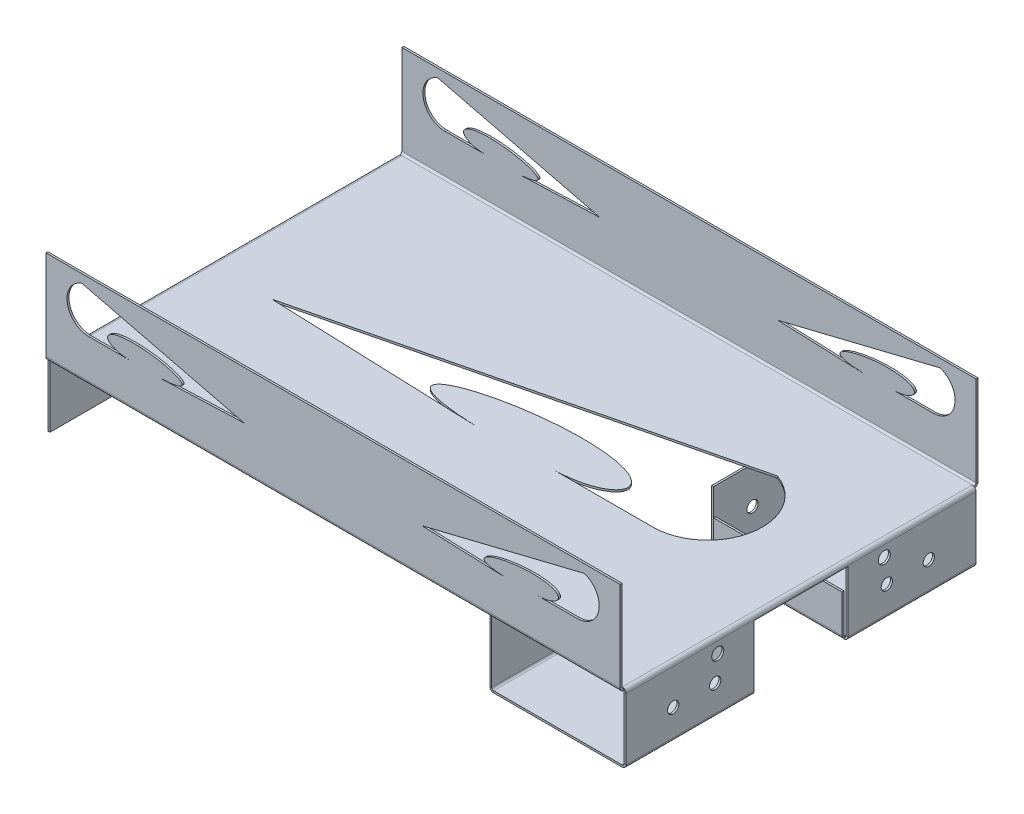
from build123d import *

# Parameters (mm, degrees)
BASE_FLANGE1_START             = -0.7366
BASE_FLANGE1_OUTLINE_W         = 219
BASE_FLANGE1_OUTLINE_H         = 135
BASE_FLANGE1_DEPTH             = 0.7366
EDGE_FLANGE1_STRIP_W           = 4.4196
EDGE_FLANGE1_STRIP_H           = 0.7366
EDGE_FLANGE1_STRIP_CUT_DEPTH   = 219
EDGE_FLANGE1_STRIP_2_W         = 4.4196
EDGE_FLANGE1_STRIP_2_H         = 0.7366
EDGE_FLANGE1_STRIP_CUT_2_DEPTH = 219
EDGE_FLANGE1_DEPTH             = 219
EDGE_FLANGE1_BEND_DEPTH        = 219
CUT_EXTRUDE1_DEPTH             = 179.438180724
EDGE_FLANGE2_STRIP_W           = 4.4196
EDGE_FLANGE2_STRIP_H           = 0.7366
EDGE_FLANGE2_STRIP_CUT_DEPTH   = 133.5268
EDGE_FLANGE2_DEPTH             = 133.5268
EDGE_FLANGE2_START             = 0.7366
EDGE_FLANGE2_PROFILE_R         = 2.3
EDGE_FLANGE2_FLAT_DEPTH        = 0.7366
EDGE_FLANGE3_STRIP_W           = 4.4196
EDGE_FLANGE3_STRIP_H           = 0.7366
EDGE_FLANGE3_STRIP_CUT_DEPTH   = 133.5268
EDGE_FLANGE3_DEPTH             = 133.5268
EDGE_FLANGE3_START             = 0.7366
EDGE_FLANGE3_PROFILE_W         = 133.5268
EDGE_FLANGE3_PROFILE_H         = 23.5268
EDGE_FLANGE3_PROFILE_R         = 2.3
EDGE_FLANGE3_FLAT_DEPTH        = 0.7366
EDGE_FLANGE5_STRIP_W           = 4.4196
EDGE_FLANGE5_STRIP_H           = 0.7366
EDGE_FLANGE5_STRIP_CUT_DEPTH   = 48.873903832
EDGE_FLANGE5_STRIP_2_W         = 4.4196
EDGE_FLANGE5_STRIP_2_H         = 0.7366
EDGE_FLANGE5_STRIP_CUT_2_DEPTH = 48.873903832
EDGE_FLANGE5_DEPTH             = 48.873903832
EDGE_FLANGE5_BEND_DEPTH        = 48.873903832
EDGE_FLANGE6_STRIP_W           = 4.4196
EDGE_FLANGE6_STRIP_H           = 0.7366
EDGE_FLANGE6_STRIP_CUT_DEPTH   = 48.873903832
EDGE_FLANGE6_STRIP_2_W         = 4.4196
EDGE_FLANGE6_STRIP_2_H         = 0.7366
EDGE_FLANGE6_STRIP_CUT_2_DEPTH = 48.873903832
EDGE_FLANGE6_DEPTH             = 48.873903832
EDGE_FLANGE6_BEND_DEPTH        = 48.873903832
EDGE_FLANGE7_STRIP_W           = 4.4196
EDGE_FLANGE7_STRIP_H           = 0.7366
EDGE_FLANGE7_STRIP_CUT_DEPTH   = 49
EDGE_FLANGE7_STRIP_2_W         = 4.4196
EDGE_FLANGE7_STRIP_2_H         = 0.7366
EDGE_FLANGE7_STRIP_CUT_2_DEPTH = 49
EDGE_FLANGE7_DEPTH             = 49
EDGE_FLANGE7_BEND_DEPTH        = 49
CUT_EXTRUDE7_DEPTH             = 356.603499813
CUT_EXTRUDE7_DEPTH_BACK        = 356.603499813
SKETCH48_R                     = 2.15
CUT_EXTRUDE8_DEPTH             = 356.603499813
CUT_EXTRUDE8_DEPTH_BACK        = 356.603499813
SKETCH49_R                     = 2.15
CUT_EXTRUDE9_DEPTH             = 356.603499813
CUT_EXTRUDE9_DEPTH_BACK        = 356.603499813
SKETCH50_R                     = 2.15
CUT_EXTRUDE10_DEPTH            = 356.603499813
CUT_EXTRUDE10_DEPTH_BACK       = 356.603499813
SKETCH51_R                     = 2.15
CUT_EXTRUDE11_DEPTH            = 242.220100311
CUT_EXTRUDE11_DEPTH_BACK       = 242.220100311
SKETCH52_R                     = 2.2


# Read off the part's stored shape, not the designer's step: Base-Flange1
# Sheet-metal steps are written as plain solids
with BuildPart() as part:
    # Base-Flange1 outline → Base-Flange1 (new body)
    with BuildSketch(Plane(origin=(0, 0, 0), x_dir=(1, 0, 0), z_dir=(0, 1, 0)).offset(BASE_FLANGE1_START)):
        Rectangle(BASE_FLANGE1_OUTLINE_W, BASE_FLANGE1_OUTLINE_H)
        with BuildLine():
            add(Edge.make_bspline(
                [(-5.291233306, -8.463206775), (-86.20750035, -5.449734888), (68.616048382, 32.565126499), (61.818563506, -8.07917062), (23.558446726, -8.07917062)],
                knots=[0, 0, 0, 0, 0, 1, 1, 1, 1, 1], degree=4))
            Line((-5.291233306, -8.463206775), (-86.20750035, -5.449734888))
            Line((-86.20750035, -5.449734888), (68.616048382, 32.565126499))
            ThreePointArc((68.616048382, 32.565126499), (82.422960421, 9.365448141), (61.818563506, -8.07917062))
            Line((61.818563506, -8.07917062), (23.558446726, -8.07917062))
        make_face(mode=Mode.SUBTRACT)
    extrude(amount=BASE_FLANGE1_DEPTH)

    # Edge-Flange1 strip (across the edge) → Edge-Flange1 strip cut (cut)
    with BuildSketch(Plane(origin=(-109.5, 0, 67.5), x_dir=(0, 0, -1), z_dir=(1, 0, 0))):
        with Locations((-1.4732, -0.3683)):
            Rectangle(EDGE_FLANGE1_STRIP_W, EDGE_FLANGE1_STRIP_H)
    extrude(amount=EDGE_FLANGE1_STRIP_CUT_DEPTH, mode=Mode.SUBTRACT)

    # Edge-Flange1 strip 2 (across the edge) → Edge-Flange1 strip cut 2 (cut)
    with BuildSketch(Plane(origin=(109.5, 0, -67.5), x_dir=(0, 0, 1), z_dir=(-1, 0, 0))):
        with Locations((-1.4732, -0.3683)):
            Rectangle(EDGE_FLANGE1_STRIP_2_W, EDGE_FLANGE1_STRIP_2_H)
    extrude(amount=EDGE_FLANGE1_STRIP_CUT_2_DEPTH, mode=Mode.SUBTRACT)

    # Edge-Flange1 section (across the edge) → Edge-Flange1 (add)
    with BuildSketch(Plane(origin=(-109.5, 0, 67.5), x_dir=(0, 0, -1), z_dir=(1, 0, 0))):
        with BuildLine():
            Line((-0.7366, 0.7366), (-0.7366, 35))
            Line((-0.7366, 35), (0, 35))
            Line((0, 35), (0, 0.7366))
            ThreePointArc((0, 0.7366), (0.215745145, 0.215745145), (0.7366, 0))
            Line((0.7366, 0), (0.7366, -0.7366))
            ThreePointArc((0.7366, -0.7366), (-0.30510971, -0.30510971), (-0.7366, 0.7366))
        make_face()
    extrude(amount=EDGE_FLANGE1_DEPTH)

    # Edge-Flange1 section 2 (across the edge) → Edge-Flange1 bend (add)
    with BuildSketch(Plane(origin=(109.5, 0, -67.5), x_dir=(0, 0, 1), z_dir=(-1, 0, 0))):
        with BuildLine():
            Line((-0.7366, 0.7366), (-0.7366, 35))
            Line((-0.7366, 35), (0, 35))
            Line((0, 35), (0, 0.7366))
            ThreePointArc((0, 0.7366), (0.215745145, 0.215745145), (0.7366, 0))
            Line((0.7366, 0), (0.7366, -0.7366))
            ThreePointArc((0.7366, -0.7366), (-0.30510971, -0.30510971), (-0.7366, 0.7366))
        make_face()
    extrude(amount=EDGE_FLANGE1_BEND_DEPTH)

    # Sketch13 → Cut-Extrude1 (cut, through all)
    with BuildSketch(Plane.XY.offset(68.2366)):
        with BuildLine():
            Line((77.825189915, 15.538033098), (93.129236627, 15.538033098))
            ThreePointArc((93.129236627, 15.538033098), (101.370995393, 22.515880602), (95.848230578, 31.795751945))
            Line((95.848230578, 31.795751945), (33.918811085, 16.589807391))
            Line((33.918811085, 16.589807391), (66.285317903, 15.384418636))
            add(Edge.make_bspline(
                [(66.285317903, 15.384418636), (33.918811085, 16.589807391), (95.848230578, 31.795751945), (93.129236627, 15.538033098), (77.825189915, 15.538033098)],
                knots=[0, 0, 0, 0, 0, 1, 1, 1, 1, 1], degree=4))
        make_face()
        with BuildLine():
            Line((-95.848230578, 31.795751945), (-33.918811085, 16.589807391))
            Line((-33.918811085, 16.589807391), (-66.285317903, 15.384418636))
            add(Edge.make_bspline(
                [(-66.285317903, 15.384418636), (-33.918811085, 16.589807391), (-95.848230578, 31.795751945), (-93.129236627, 15.538033098), (-77.825189915, 15.538033098)],
                knots=[0, 0, 0, 0, 0, 1, 1, 1, 1, 1], degree=4))
            Line((-77.825189915, 15.538033098), (-93.129236627, 15.538033098))
            ThreePointArc((-93.129236627, 15.538033098), (-101.370995393, 22.515880602), (-95.848230578, 31.795751945))
        make_face()
    extrude(amount=-CUT_EXTRUDE1_DEPTH, mode=Mode.SUBTRACT)

    # Edge-Flange2 strip (across the edge) → Edge-Flange2 strip cut (cut)
    with BuildSketch(Plane(origin=(109.5, -0.7366, -66.7634), x_dir=(-1, 0, 0), z_dir=(0, 0, 1))):
        with Locations((-1.4732, -0.3683)):
            Rectangle(EDGE_FLANGE2_STRIP_W, EDGE_FLANGE2_STRIP_H)
    extrude(amount=EDGE_FLANGE2_STRIP_CUT_DEPTH, mode=Mode.SUBTRACT)

    # Edge-Flange2 bend section (across the edge) → Edge-Flange2 (add)
    with BuildSketch(Plane(origin=(109.5, -0.7366, -66.7634), x_dir=(-1, 0, 0), z_dir=(0, 0, 1))):
        with BuildLine():
            Line((-0.7366, 0.7366), (0, 0.7366))
            ThreePointArc((0, 0.7366), (0.215745145, 0.215745145), (0.7366, 0))
            Line((0.7366, 0), (0.7366, -0.7366))
            ThreePointArc((0.7366, -0.7366), (-0.30510971, -0.30510971), (-0.7366, 0.7366))
        make_face()
    extrude(amount=EDGE_FLANGE2_DEPTH)

    # Edge-Flange2 profile (on flange) → Edge-Flange2 flat (add)
    with BuildSketch(Plane(origin=(109.5, -0.7366, 0), x_dir=(0, 0, 1), z_dir=(1, 0, 0)).offset(EDGE_FLANGE2_START)):
        Polygon((66.7634, 0.7366), (66.7634, 25), (17.889496168, 25), (17.889496168, 1), (-17.889496168, 1), (-17.889496168, 25), (-66.7634, 25), (-66.7634, 0.7366), align=None)
        with Locations((31.7634, 5)):
            Circle(EDGE_FLANGE2_PROFILE_R, mode=Mode.SUBTRACT)
        with Locations((-31.7634, 5)):
            Circle(EDGE_FLANGE2_PROFILE_R, mode=Mode.SUBTRACT)
    extrude(amount=-EDGE_FLANGE2_FLAT_DEPTH)

    # Edge-Flange3 strip (across the edge) → Edge-Flange3 strip cut (cut)
    with BuildSketch(Plane(origin=(-109.5, -0.7366, 66.7634), x_dir=(1, 0, 0), z_dir=(0, 0, -1))):
        with Locations((-1.4732, -0.3683)):
            Rectangle(EDGE_FLANGE3_STRIP_W, EDGE_FLANGE3_STRIP_H)
    extrude(amount=EDGE_FLANGE3_STRIP_CUT_DEPTH, mode=Mode.SUBTRACT)

    # Edge-Flange3 bend section (across the edge) → Edge-Flange3 (add)
    with BuildSketch(Plane(origin=(-109.5, -0.7366, 66.7634), x_dir=(1, 0, 0), z_dir=(0, 0, -1))):
        with BuildLine():
            Line((-0.7366, 0.7366), (0, 0.7366))
            ThreePointArc((0, 0.7366), (0.215745145, 0.215745145), (0.7366, 0))
            Line((0.7366, 0), (0.7366, -0.7366))
            ThreePointArc((0.7366, -0.7366), (-0.30510971, -0.30510971), (-0.7366, 0.7366))
        make_face()
    extrude(amount=EDGE_FLANGE3_DEPTH)

    # Edge-Flange3 profile (on flange) → Edge-Flange3 flat (add)
    with BuildSketch(Plane(origin=(-109.5, -0.7366, 0), x_dir=(0, 0, -1), z_dir=(-1, 0, 0)).offset(EDGE_FLANGE3_START)):
        with Locations((0, 12.5)):
            Rectangle(EDGE_FLANGE3_PROFILE_W, EDGE_FLANGE3_PROFILE_H)
        with Locations((-0.0016, 10)):
            Circle(EDGE_FLANGE3_PROFILE_R, mode=Mode.SUBTRACT)
    extrude(amount=-EDGE_FLANGE3_FLAT_DEPTH)

    # Edge-Flange5 strip (across the edge) → Edge-Flange5 strip cut (cut)
    with BuildSketch(Plane(origin=(109.5, -25.7366, -66.7634), x_dir=(0, 1, 0), z_dir=(0, 0, 1))):
        with Locations((-1.4732, -0.3683)):
            Rectangle(EDGE_FLANGE5_STRIP_W, EDGE_FLANGE5_STRIP_H)
    extrude(amount=EDGE_FLANGE5_STRIP_CUT_DEPTH, mode=Mode.SUBTRACT)

    # Edge-Flange5 strip 2 (across the edge) → Edge-Flange5 strip cut 2 (cut)
    with BuildSketch(Plane(origin=(109.5, -25.7366, 17.889496168), x_dir=(0, 1, 0), z_dir=(0, 0, 1))):
        with Locations((-1.4732, -0.3683)):
            Rectangle(EDGE_FLANGE5_STRIP_2_W, EDGE_FLANGE5_STRIP_2_H)
    extrude(amount=EDGE_FLANGE5_STRIP_CUT_2_DEPTH, mode=Mode.SUBTRACT)

    # Edge-Flange5 section (across the edge) → Edge-Flange5 (add)
    with BuildSketch(Plane(origin=(109.5, -25.7366, -66.7634), x_dir=(0, 1, 0), z_dir=(0, 0, 1))):
        with BuildLine():
            Line((-0.7366, 0.7366), (-0.7366, 50.4732))
            Line((-0.7366, 50.4732), (0, 50.4732))
            Line((0, 50.4732), (0, 0.7366))
            ThreePointArc((0, 0.7366), (0.215745145, 0.215745145), (0.7366, 0))
            Line((0.7366, 0), (0.7366, -0.7366))
            ThreePointArc((0.7366, -0.7366), (-0.30510971, -0.30510971), (-0.7366, 0.7366))
        make_face()
    extrude(amount=EDGE_FLANGE5_DEPTH)

    # Edge-Flange5 section 2 (across the edge) → Edge-Flange5 bend (add)
    with BuildSketch(Plane(origin=(109.5, -25.7366, 17.889496168), x_dir=(0, 1, 0), z_dir=(0, 0, 1))):
        with BuildLine():
            Line((-0.7366, 0.7366), (-0.7366, 50.4732))
            Line((-0.7366, 50.4732), (0, 50.4732))
            Line((0, 50.4732), (0, 0.7366))
            ThreePointArc((0, 0.7366), (0.215745145, 0.215745145), (0.7366, 0))
            Line((0.7366, 0), (0.7366, -0.7366))
            ThreePointArc((0.7366, -0.7366), (-0.30510971, -0.30510971), (-0.7366, 0.7366))
        make_face()
    extrude(amount=EDGE_FLANGE5_BEND_DEPTH)

    # Edge-Flange6 strip (across the edge) → Edge-Flange6 strip cut (cut)
    with BuildSketch(Plane(origin=(59.0268, -25.7366, -66.7634), x_dir=(1, 0, 0), z_dir=(0, 0, 1))):
        with Locations((-1.4732, -0.3683)):
            Rectangle(EDGE_FLANGE6_STRIP_W, EDGE_FLANGE6_STRIP_H)
    extrude(amount=EDGE_FLANGE6_STRIP_CUT_DEPTH, mode=Mode.SUBTRACT)

    # Edge-Flange6 strip 2 (across the edge) → Edge-Flange6 strip cut 2 (cut)
    with BuildSketch(Plane(origin=(59.0268, -25.7366, 17.889496168), x_dir=(1, 0, 0), z_dir=(0, 0, 1))):
        with Locations((-1.4732, -0.3683)):
            Rectangle(EDGE_FLANGE6_STRIP_2_W, EDGE_FLANGE6_STRIP_2_H)
    extrude(amount=EDGE_FLANGE6_STRIP_CUT_2_DEPTH, mode=Mode.SUBTRACT)

    # Edge-Flange6 section (across the edge) → Edge-Flange6 (add)
    with BuildSketch(Plane(origin=(59.0268, -25.7366, -66.7634), x_dir=(1, 0, 0), z_dir=(0, 0, 1))):
        with BuildLine():
            Line((-0.7366, 0.7366), (-0.7366, 24.7634))
            Line((-0.7366, 24.7634), (0, 24.7634))
            Line((0, 24.7634), (0, 0.7366))
            ThreePointArc((0, 0.7366), (0.215745145, 0.215745145), (0.7366, 0))
            Line((0.7366, 0), (0.7366, -0.7366))
            ThreePointArc((0.7366, -0.7366), (-0.30510971, -0.30510971), (-0.7366, 0.7366))
        make_face()
    extrude(amount=EDGE_FLANGE6_DEPTH)

    # Edge-Flange6 section 2 (across the edge) → Edge-Flange6 bend (add)
    with BuildSketch(Plane(origin=(59.0268, -25.7366, 17.889496168), x_dir=(1, 0, 0), z_dir=(0, 0, 1))):
        with BuildLine():
            Line((-0.7366, 0.7366), (-0.7366, 24.7634))
            Line((-0.7366, 24.7634), (0, 24.7634))
            Line((0, 24.7634), (0, 0.7366))
            ThreePointArc((0, 0.7366), (0.215745145, 0.215745145), (0.7366, 0))
            Line((0.7366, 0), (0.7366, -0.7366))
            ThreePointArc((0.7366, -0.7366), (-0.30510971, -0.30510971), (-0.7366, 0.7366))
        make_face()
    extrude(amount=EDGE_FLANGE6_BEND_DEPTH)

    # Edge-Flange7 strip (across the edge) → Edge-Flange7 strip cut (cut)
    with BuildSketch(Plane(origin=(59.7634, -25.7366, -17.889496168), x_dir=(0, 0, -1), z_dir=(1, 0, 0))):
        with Locations((-1.4732, -0.3683)):
            Rectangle(EDGE_FLANGE7_STRIP_W, EDGE_FLANGE7_STRIP_H)
    extrude(amount=EDGE_FLANGE7_STRIP_CUT_DEPTH, mode=Mode.SUBTRACT)

    # Edge-Flange7 strip 2 (across the edge) → Edge-Flange7 strip cut 2 (cut)
    with BuildSketch(Plane(origin=(108.7634, -25.7366, 17.889496168), x_dir=(0, 0, 1), z_dir=(-1, 0, 0))):
        with Locations((-1.4732, -0.3683)):
            Rectangle(EDGE_FLANGE7_STRIP_2_W, EDGE_FLANGE7_STRIP_2_H)
    extrude(amount=EDGE_FLANGE7_STRIP_CUT_2_DEPTH, mode=Mode.SUBTRACT)

    # Edge-Flange7 section (across the edge) → Edge-Flange7 (add)
    with BuildSketch(Plane(origin=(59.7634, -25.7366, -17.889496168), x_dir=(0, 0, -1), z_dir=(1, 0, 0))):
        with BuildLine():
            Line((-0.7366, 0.7366), (-0.7366, 15.1534))
            Line((-0.7366, 15.1534), (0, 15.1534))
            Line((0, 15.1534), (0, 0.7366))
            ThreePointArc((0, 0.7366), (0.215745145, 0.215745145), (0.7366, 0))
            Line((0.7366, 0), (0.7366, -0.7366))
            ThreePointArc((0.7366, -0.7366), (-0.30510971, -0.30510971), (-0.7366, 0.7366))
        make_face()
    extrude(amount=EDGE_FLANGE7_DEPTH)

    # Edge-Flange7 section 2 (across the edge) → Edge-Flange7 bend (add)
    with BuildSketch(Plane(origin=(108.7634, -25.7366, 17.889496168), x_dir=(0, 0, 1), z_dir=(-1, 0, 0))):
        with BuildLine():
            Line((-0.7366, 0.7366), (-0.7366, 15.1534))
            Line((-0.7366, 15.1534), (0, 15.1534))
            Line((0, 15.1534), (0, 0.7366))
            ThreePointArc((0, 0.7366), (0.215745145, 0.215745145), (0.7366, 0))
            Line((0.7366, 0), (0.7366, -0.7366))
            ThreePointArc((0.7366, -0.7366), (-0.30510971, -0.30510971), (-0.7366, 0.7366))
        make_face()
    extrude(amount=EDGE_FLANGE7_BEND_DEPTH)

    # Sketch48 → Cut-Extrude7 (cut, two sides: drawn at the far end of the back side and taken through both)
    with BuildSketch(Plane(origin=(-109.5, -129.073520316, -158.147046832), x_dir=(0, 0, -1), z_dir=(1, 0, 0)).offset(-CUT_EXTRUDE7_DEPTH_BACK)):
        with Locations(Location((-206.883646832, 114.073520316, 0), (0, 0, 90))):
            Circle(SKETCH48_R)
    extrude(amount=CUT_EXTRUDE7_DEPTH + CUT_EXTRUDE7_DEPTH_BACK, mode=Mode.SUBTRACT)

    # Sketch49 → Cut-Extrude8 (cut, two sides: drawn at the far end of the back side and taken through both)
    with BuildSketch(Plane(origin=(-109.5, -129.073520316, -158.147046832), x_dir=(0, 0, -1), z_dir=(1, 0, 0)).offset(-CUT_EXTRUDE8_DEPTH_BACK)):
        with Locations(Location((-190.883646832, 114.073520316, 0), (0, 0, 90))):
            Circle(SKETCH49_R)
    extrude(amount=CUT_EXTRUDE8_DEPTH + CUT_EXTRUDE8_DEPTH_BACK, mode=Mode.SUBTRACT)

    # Sketch50 → Cut-Extrude9 (cut, two sides: drawn at the far end of the back side and taken through both)
    with BuildSketch(Plane(origin=(-109.5, -129.073520316, -158.147046832), x_dir=(0, 0, -1), z_dir=(1, 0, 0)).offset(-CUT_EXTRUDE9_DEPTH_BACK)):
        with Locations(Location((-125.410446832, 114.073520316, 0), (0, 0, 90))):
            Circle(SKETCH50_R)
    extrude(amount=CUT_EXTRUDE9_DEPTH + CUT_EXTRUDE9_DEPTH_BACK, mode=Mode.SUBTRACT)

    # Sketch51 → Cut-Extrude10 (cut, two sides: drawn at the far end of the back side and taken through both)
    with BuildSketch(Plane(origin=(-109.5, -129.073520316, -158.147046832), x_dir=(0, 0, -1), z_dir=(1, 0, 0)).offset(-CUT_EXTRUDE10_DEPTH_BACK)):
        with Locations(Location((-109.410446832, 114.073520316, 0), (0, 0, 90))):
            Circle(SKETCH51_R)
    extrude(amount=CUT_EXTRUDE10_DEPTH + CUT_EXTRUDE10_DEPTH_BACK, mode=Mode.SUBTRACT)

    # Sketch52 → Cut-Extrude11 (cut, two sides: drawn at the far end of the back side and taken through both)
    with BuildSketch(Plane(origin=(-91.609050435, -65.138732346, -17.889496168), x_dir=(-1, 0, 0), z_dir=(0, 0, -1)).offset(-CUT_EXTRUDE11_DEPTH_BACK)):
        with Locations(Location((-162.341738548, 50.138732346, 0), (0, 0, 270))):
            Circle(SKETCH52_R)
    extrude(amount=CUT_EXTRUDE11_DEPTH + CUT_EXTRUDE11_DEPTH_BACK, mode=Mode.SUBTRACT)


solid = part.part
